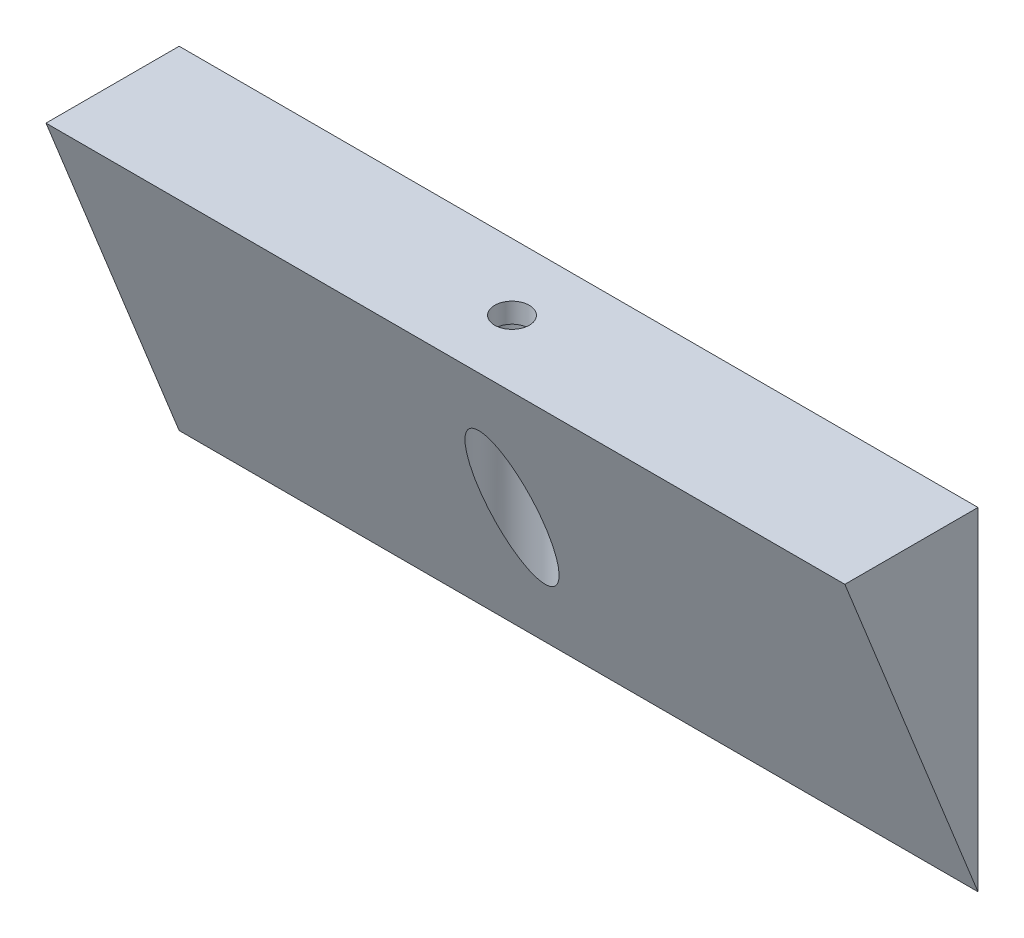
from build123d import *

# Parameters (mm, degrees)
SKETCH_1_W          = 120
SKETCH_1_H          = 20
EXTRUDE_1_DEPTH     = 50
SKETCH_2_W          = 6
SKETCH_2_H          = 20
EXTRUDE_2_DEPTH     = 20
CUT_EXTRUDE_1_DEPTH = 114
SKETCH_4_R          = 2.6
SKETCH_4_W          = 20
SKETCH_4_H          = 20
CUT_EXTRUDE_2_DEPTH = 114
SKETCH_5_R          = 5
CUT_EXTRUDE_3_DEPTH = 3
SKETCH_6_R          = 2.6
CUT_EXTRUDE_4_DEPTH = 300
SKETCH_8_R          = 5
CUT_EXTRUDE_5_DEPTH = 300
SKETCH_9_R          = 5
SKETCH_9_R_2        = 2.6
EXTRUDE_3_DEPTH     = 3
SKETCH_11_W         = 120
SKETCH_11_H         = 20
CUT_EXTRUDE_6_DEPTH = 100
CUT_EXTRUDE_7_DEPTH = 10


with BuildPart() as part:
    # 草图1 → 凸台-拉伸1 (new body)
    with BuildSketch(Plane(origin=(0, 0, 0), x_dir=(1, 0, 0), z_dir=(0, 1, 0))):
        with Locations((60, 10)):
            Rectangle(SKETCH_1_W, SKETCH_1_H)
    extrude_1 = extrude(amount=EXTRUDE_1_DEPTH)

    # 草图2 → 凸台-拉伸2 (add)
    with BuildSketch(Plane.XY):
        with Locations((3, -10)):
            Rectangle(SKETCH_2_W, SKETCH_2_H)
    extrude_2 = extrude(amount=-EXTRUDE_2_DEPTH)

    # 草图3 → 切除-拉伸1 (cut)
    with BuildSketch(Plane(origin=(120, 0, 0), x_dir=(0, 0, -1), z_dir=(1, 0, 0))):
        Polygon((0, 50), (20, 0), (0, 0), align=None)
    cut_extrude_1 = extrude(amount=-CUT_EXTRUDE_1_DEPTH, mode=Mode.SUBTRACT)

    # 草图4 → 切除-拉伸2 (cut)
    with BuildSketch(Plane(origin=(6, 0, 0), x_dir=(0, 0, -1), z_dir=(1, 0, 0))):
        with Locations((10, 10)):
            Circle(SKETCH_4_R)
        with Locations((10, -10)):
            Rectangle(SKETCH_4_W, SKETCH_4_H)
    cut_extrude_2 = extrude(amount=-CUT_EXTRUDE_2_DEPTH, mode=Mode.SUBTRACT)

    # 草图5 → 切除-拉伸3 (cut)
    with BuildSketch(Plane(origin=(6, 0, 0), x_dir=(0, 0, -1), z_dir=(1, 0, 0))):
        with Locations((10, 10)):
            Circle(SKETCH_5_R)
    cut_extrude_3 = extrude(amount=-CUT_EXTRUDE_3_DEPTH, mode=Mode.SUBTRACT)

    # 草图6 → 切除-拉伸4 (cut)
    with BuildSketch(Plane(origin=(0, 50, 0), x_dir=(1, 0, 0), z_dir=(0, 1, 0))):
        with Locations((60, 10)):
            Circle(SKETCH_6_R)
    extrude(amount=-CUT_EXTRUDE_4_DEPTH, mode=Mode.SUBTRACT)

    # 草图8 → 切除-拉伸5 (cut)
    with BuildSketch(Plane(origin=(0, 50, 0), x_dir=(1, 0, 0), z_dir=(0, 1, 0))):
        with Locations((60, 10)):
            Circle(SKETCH_8_R)
    cut_extrude_5 = extrude(amount=-CUT_EXTRUDE_5_DEPTH, mode=Mode.SUBTRACT)

    # 草图9 → 凸台-拉伸3 (add)
    with BuildSketch(Plane(origin=(0, 50, 0), x_dir=(1, 0, 0), z_dir=(0, 1, 0))):
        with Locations((60, 10)):
            Circle(SKETCH_9_R)
        with Locations((60, 10)):
            Circle(SKETCH_9_R_2, mode=Mode.SUBTRACT)
    extrude_3 = extrude(amount=-EXTRUDE_3_DEPTH)

    # 镜向2: 凸台-拉伸1, 凸台-拉伸2, 切除-拉伸1, 切除-拉伸2, 切除-拉伸3, 切除-拉伸5, 凸台-拉伸3 across plane
    add(extrude_1.mirror(Plane(origin=(120, 50, 0), x_dir=(0, 0, 1), z_dir=(-1, 0, 0))))
    add(extrude_2.mirror(Plane(origin=(120, 50, 0), x_dir=(0, 0, 1), z_dir=(-1, 0, 0))))
    add(cut_extrude_1.mirror(Plane(origin=(120, 50, 0), x_dir=(0, 0, 1), z_dir=(-1, 0, 0))), mode=Mode.SUBTRACT)
    add(cut_extrude_2.mirror(Plane(origin=(120, 50, 0), x_dir=(0, 0, 1), z_dir=(-1, 0, 0))), mode=Mode.SUBTRACT)
    add(cut_extrude_3.mirror(Plane(origin=(120, 50, 0), x_dir=(0, 0, 1), z_dir=(-1, 0, 0))), mode=Mode.SUBTRACT)
    add(cut_extrude_5.mirror(Plane(origin=(120, 50, 0), x_dir=(0, 0, 1), z_dir=(-1, 0, 0))), mode=Mode.SUBTRACT)
    add(extrude_3.mirror(Plane(origin=(120, 50, 0), x_dir=(0, 0, 1), z_dir=(-1, 0, 0))))

    # 草图11 → 切除-拉伸6 (cut)
    with BuildSketch(Plane(origin=(0, 50, 0), x_dir=(1, 0, 0), z_dir=(0, 1, 0))):
        with Locations((60, 10)):
            Rectangle(SKETCH_11_W, SKETCH_11_H)
    extrude(amount=-CUT_EXTRUDE_6_DEPTH, mode=Mode.SUBTRACT)

    # 草图12 → 切除-拉伸7 (cut)
    with BuildSketch(Plane.ZY.offset(-234)):
        Polygon((-20, 0), (0, 0), (0, 50), align=None)
    extrude(amount=-CUT_EXTRUDE_7_DEPTH, mode=Mode.SUBTRACT)


solid = part.part
